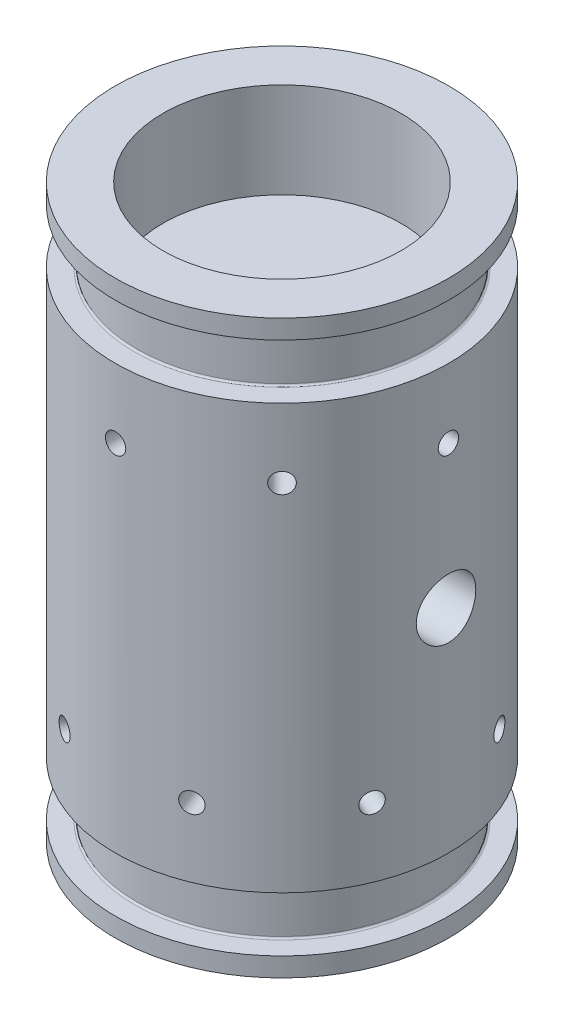
from build123d import *

# Parameters (mm, degrees)
SKETCH1_R                             = 22.225
BODY_DEPTH                            = 38.1
SKETCH2_R                             = 15.875
LIGHTENING_HOLE_DEPTH                 = 12.7
TAPPED_HOLE_PATTERN_COUNT             = 8
F_1_4_20_0_250_PISTON_STOP_VENT_D     = 5.1054
F_1_4_20_0_250_PISTON_STOP_VENT_DEPTH = 7.62
F_1_4_20_0_250_PISTON_STOP_VENT_TIP   = 1.533816902
F_5_16_0_3125_PISTON_BORE_D           = 7.9375
F_5_16_0_3125_PISTON_BORE_DEPTH       = 36.068
F_5_16_0_3125_PISTON_BORE_TIP         = 2.384665582
F_3_8_16_THREAD_BLAST_CAP_D           = 7.9375
F_3_8_16_THREAD_BLAST_CAP_DEPTH       = 9.525
F_3_8_16_THREAD_BLAST_CAP_TIP         = 2.384665582


with BuildPart() as part:
    # Sketch1 → body (new, symmetric)
    with BuildSketch(Plane(origin=(0, 0, 0), x_dir=(1, 0, 0), z_dir=(0, 1, 0))):
        Circle(SKETCH1_R)
    extrude(amount=BODY_DEPTH, both=True)

    # Sketch2 → lightening hole (cut)
    with BuildSketch(Plane(origin=(0, 38.1, 0), x_dir=(1, 0, 0), z_dir=(0, 1, 0))):
        Circle(SKETCH2_R)
    lightening_hole = extrude(amount=-LIGHTENING_HOLE_DEPTH, mode=Mode.SUBTRACT)

    # main-o-ring → o-ring-main (with backup rings) (revolve, cut)
    with BuildSketch(Plane.XY):
        with BuildLine():
            Line((-22.225, 35.56), (-22.225, 28.2702))
            Line((-22.225, 28.2702), (-19.620412385, 28.2702))
            ThreePointArc((-19.620412385, 28.2702), (-19.450556579, 28.340556579), (-19.3802, 28.510412385))
            Line((-19.3802, 28.510412385), (-19.3802, 35.319787615))
            ThreePointArc((-19.3802, 35.319787615), (-19.450556579, 35.489643421), (-19.620412385, 35.56))
            Line((-19.620412385, 35.56), (-22.225, 35.56))
        make_face()
    o_ring_main_with_backup_rings = revolve(axis=Axis((0, 0, 0), (0, 1, 0)), mode=Mode.SUBTRACT)

    # Top-Bottom Symmetry: lightening hole, o-ring-main (with backup rings) across plane
    add(lightening_hole.mirror(Plane.ZX), mode=Mode.SUBTRACT)
    add(o_ring_main_with_backup_rings.mirror(Plane.ZX), mode=Mode.SUBTRACT)

    # Sketch3 → #6-32 Tapped Hole1 (revolve, cut)
    with BuildSketch(Plane(origin=(-22.225, 19.05, 0), x_dir=(0, 0, 1), z_dir=(0, 1, 0))):
        Polygon((0, 0), (0, 8.76289403), (1.35255, 7.9502), (1.35255, 0), align=None)
    f_6_32_tapped_hole1 = revolve(axis=Axis((-28.575, 19.05, 0), (1, 0, 0)), mode=Mode.SUBTRACT)

    # Sketch4 → #6-32 Tapped Hole2 (revolve, cut)
    with BuildSketch(Plane(origin=(-20.53322261, -19.05, -8.505139284), x_dir=(-0.38268343236509006, 0, 0.9238795325112866), z_dir=(0, 1, 0))):
        Polygon((0, 0), (0, 8.76289403), (1.35255, 7.9502), (1.35255, 0), align=None)
    f_6_32_tapped_hole2 = revolve(axis=Axis((-26.399857642, -19.05, -10.93517908), (0.9238795325112866, 0, 0.38268343236509006)), mode=Mode.SUBTRACT)

    # Tapped Hole Pattern: #6-32 Tapped Hole1, #6-32 Tapped Hole2 ×8 about axis
    tapped_hole_pattern_axis = Axis((0, 38.1, 0), (0, -1, 0))
    add([f_6_32_tapped_hole1.rotate(tapped_hole_pattern_axis, i * 360 / TAPPED_HOLE_PATTERN_COUNT) for i in range(1, TAPPED_HOLE_PATTERN_COUNT)], mode=Mode.SUBTRACT)
    add([f_6_32_tapped_hole2.rotate(tapped_hole_pattern_axis, i * 360 / TAPPED_HOLE_PATTERN_COUNT) for i in range(1, TAPPED_HOLE_PATTERN_COUNT)], mode=Mode.SUBTRACT)

    # 1/4-20 (0.250) Piston Stop/Vent
    with Locations(Plane(origin=(-22.225, 0, 0), x_dir=(0, -1, 0), z_dir=(-1, 0, 0))):
        with Locations((0, 0)):
            Hole(F_1_4_20_0_250_PISTON_STOP_VENT_D / 2, depth=F_1_4_20_0_250_PISTON_STOP_VENT_DEPTH)
            with Locations((0, 0, -(F_1_4_20_0_250_PISTON_STOP_VENT_DEPTH + F_1_4_20_0_250_PISTON_STOP_VENT_TIP / 2))):  # 118° drill point
                Cone(0, F_1_4_20_0_250_PISTON_STOP_VENT_D / 2, F_1_4_20_0_250_PISTON_STOP_VENT_TIP, mode=Mode.SUBTRACT)

    # 5/16 (0.3125) Piston Bore
    with Locations(Plane.YZ.offset(22.225)):
        with Locations((0, 0)):
            Hole(F_5_16_0_3125_PISTON_BORE_D / 2, depth=F_5_16_0_3125_PISTON_BORE_DEPTH)
            with Locations((0, 0, -(F_5_16_0_3125_PISTON_BORE_DEPTH + F_5_16_0_3125_PISTON_BORE_TIP / 2))):  # 118° drill point
                Cone(0, F_5_16_0_3125_PISTON_BORE_D / 2, F_5_16_0_3125_PISTON_BORE_TIP, mode=Mode.SUBTRACT)

    # 3/8-16 Thread Blast Cap
    with Locations(Plane.YZ.offset(22.225)):
        with Locations((0, 0)):
            Hole(F_3_8_16_THREAD_BLAST_CAP_D / 2, depth=F_3_8_16_THREAD_BLAST_CAP_DEPTH)
            with Locations((0, 0, -(F_3_8_16_THREAD_BLAST_CAP_DEPTH + F_3_8_16_THREAD_BLAST_CAP_TIP / 2))):  # 118° drill point
                Cone(0, F_3_8_16_THREAD_BLAST_CAP_D / 2, F_3_8_16_THREAD_BLAST_CAP_TIP, mode=Mode.SUBTRACT)


solid = part.part
